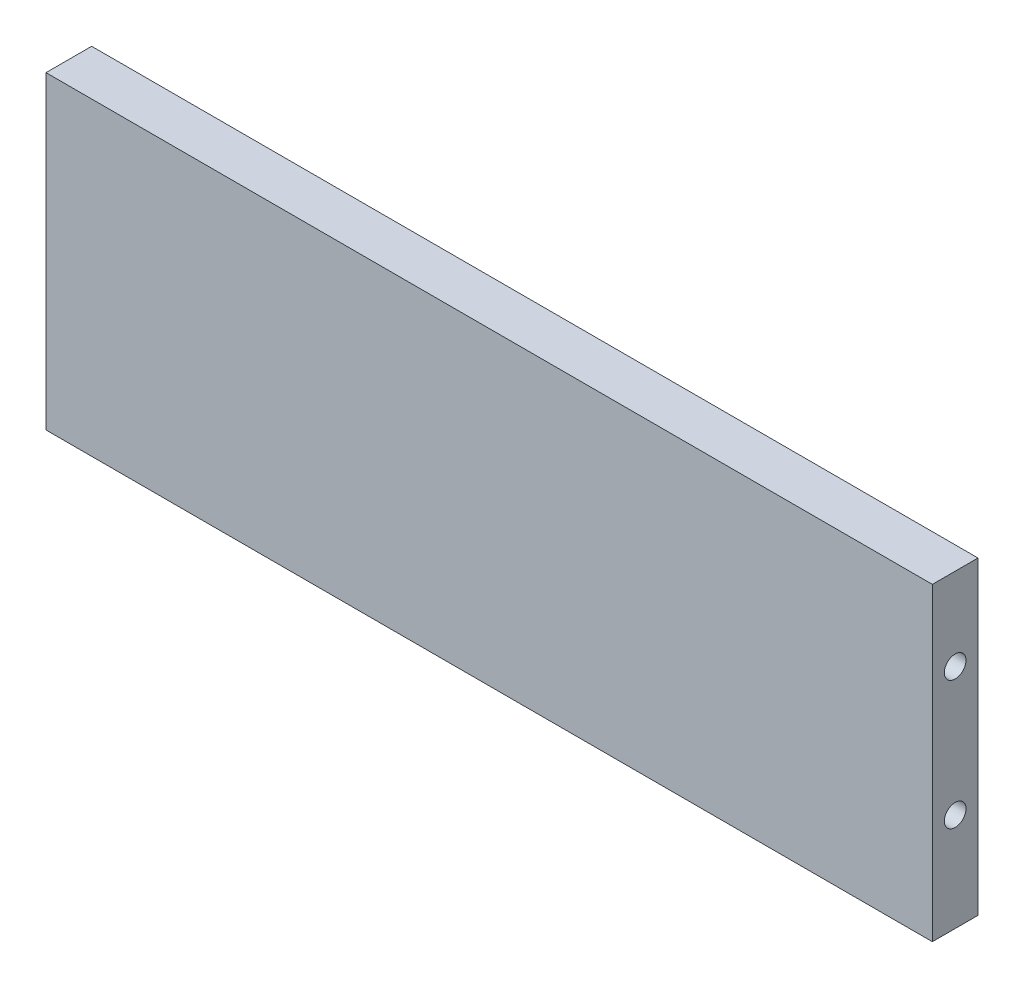
from build123d import *

# Parameters (mm, degrees)
SKETCH2_W           = 92.456
SKETCH2_H           = 32.2834
BOSS_EXTRUDE1_DEPTH = 4.7625
SKETCH3_R           = 1.1303
CUT_EXTRUDE1_DEPTH  = 94.97525111
SKETCH4_R           = 1.1303
CUT_EXTRUDE2_DEPTH  = 19.05


with BuildPart() as part:
    # Sketch2 → Boss-Extrude1 (new body)
    with BuildSketch(Plane.XY):
        Rectangle(SKETCH2_W, SKETCH2_H)
    extrude(amount=BOSS_EXTRUDE1_DEPTH)

    # Sketch3 → Cut-Extrude1 (cut, through all)
    with BuildSketch(Plane.ZY.offset(46.228)):
        with Locations((2.38125, 7.5311)):
            Circle(SKETCH3_R)
        with Locations((2.38125, -5.8801)):
            Circle(SKETCH3_R)
    extrude(amount=-CUT_EXTRUDE1_DEPTH, mode=Mode.SUBTRACT)

    # Sketch4 → Cut-Extrude2 (cut)
    with BuildSketch(Plane.XZ.offset(16.1417)):
        with Locations((-20.828, 2.38125)):
            Circle(SKETCH4_R)
        with Locations((20.828, 2.38125)):
            Circle(SKETCH4_R)
    extrude(amount=-CUT_EXTRUDE2_DEPTH, mode=Mode.SUBTRACT)


solid = part.part
